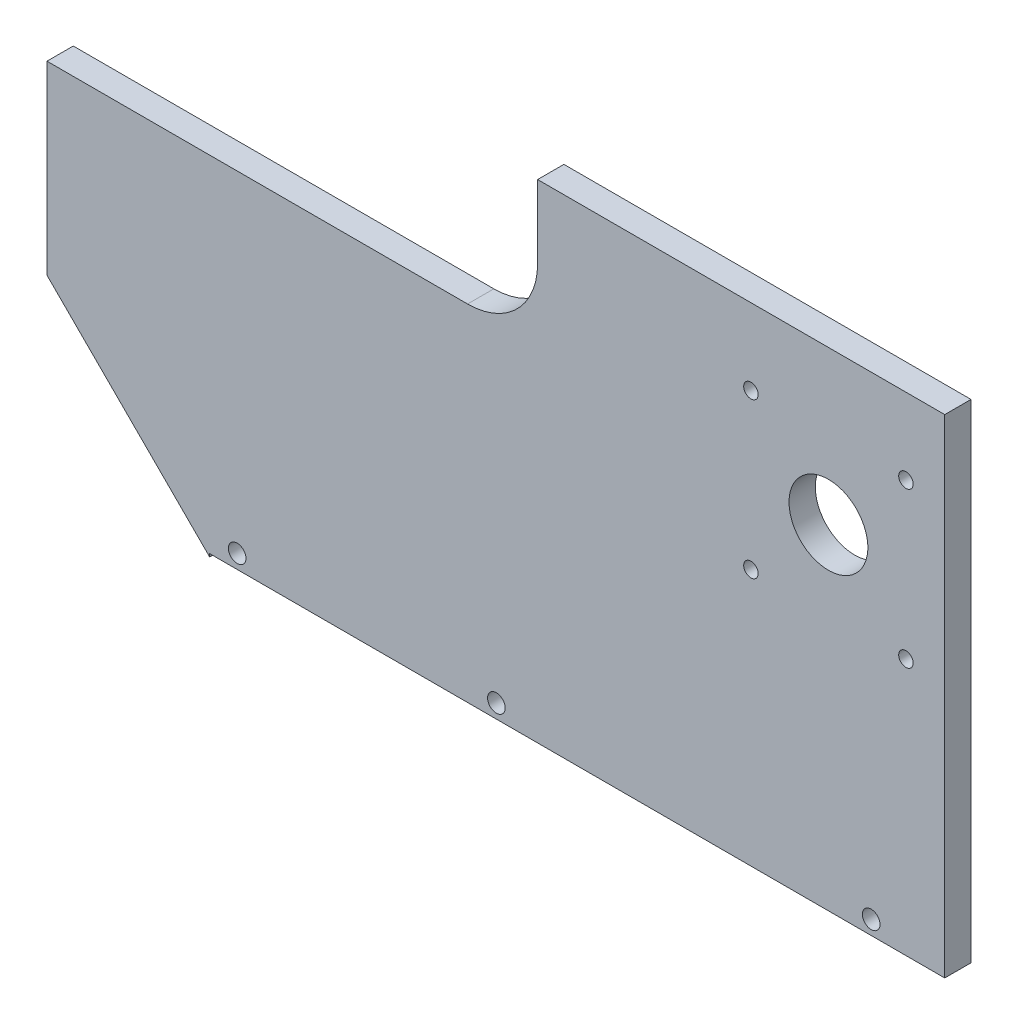
from build123d import *

# Parameters (mm, degrees)
SKETCH1_R                    = 14.2875
BOSS_EXTRUDE1_DEPTH          = 9.525
SKETCH2_W                    = 285.57287806
SKETCH2_H                    = 77.089
CUT_EXTRUDE1_DEPTH           = 269.40946762
SKETCH4_W                    = 213.36
SKETCH4_H                    = 68.767352002
CUT_EXTRUDE2_DEPTH           = 269.40946762
FILLET2_R                    = 25.4
SKETCH16_W                   = 9.525
SKETCH16_H                   = 4.28736328
CUT_EXTRUDE3_DEPTH           = 391.823448136
SKETCH17_W                   = 147.610011278
SKETCH17_H                   = 12.7
CUT_EXTRUDE4_DEPTH           = 267.045158533
TAP_DRILL_FOR_M6X0_75_TAP1_D = 5.25
F_6_4_6_4_DIAMETER_HOLE1_D   = 6.4
CUT_EXTRUDE5_DEPTH           = 260.331237793


with BuildPart() as part:
    # Sketch1 → Boss-Extrude1 (new body)
    with BuildSketch(Plane.XY):
        Polygon((-138.259383474, 48.991487021), (32.210627804, -121.478524257), (222.710627804, -121.478524257), (222.710627804, 149.508839023), (-138.259383474, 149.508839023), align=None)
        with Locations((180.538014078, 76.831975743)):
            Circle(SKETCH1_R, mode=Mode.SUBTRACT)
    extrude(amount=BOSS_EXTRUDE1_DEPTH)

    # Sketch2 → Cut-Extrude1 (cut, through all)
    with BuildSketch(Plane.XY.offset(9.525)):
        with Locations((98.974188774, -82.934024257)):
            Rectangle(SKETCH2_W, SKETCH2_H)
    extrude(amount=-CUT_EXTRUDE1_DEPTH, mode=Mode.SUBTRACT)

    # Sketch4 → Cut-Extrude2 (cut, through all)
    with BuildSketch(Plane.XY.offset(9.525)):
        with Locations((-31.579383474, 115.125163022)):
            Rectangle(SKETCH4_W, SKETCH4_H)
    extrude(amount=-CUT_EXTRUDE2_DEPTH, mode=Mode.SUBTRACT)

    # Fillet2
    fillet2_edges = [part.edges().sort_by_distance(p)[0] for p in [
        (-138.259383474, 80.741487021, 4.7625),
        (75.100616526, 80.741487021, 4.7625),
    ]]
    fillet(fillet2_edges, radius=FILLET2_R)

    # Sketch16 → Cut-Extrude3 (cut, through all)
    with BuildSketch(Plane(origin=(222.710627804, 0, 0), x_dir=(0, 0, -1), z_dir=(1, 0, 0))):
        with Locations((-4.7625, 147.365157383)):
            Rectangle(SKETCH16_W, SKETCH16_H)
    extrude(amount=-CUT_EXTRUDE3_DEPTH, mode=Mode.SUBTRACT)

    # Sketch17 → Cut-Extrude4 (cut, through all)
    with BuildSketch(Plane(origin=(0, 0, 0), x_dir=(-1, 0, 0), z_dir=(0, 0, -1))):
        with Locations((-148.905622165, 138.871475743)):
            Rectangle(SKETCH17_W, SKETCH17_H)
    extrude(amount=-CUT_EXTRUDE4_DEPTH, mode=Mode.SUBTRACT)

    # Tap Drill for M6x0.75 Tap1 (through all)
    with Locations(Plane.XY.offset(9.525)):
        with Locations((208.638014078, 104.931975743), (152.438014078, 104.931975743), (152.438014078, 48.731975743), (208.638014078, 48.731975743)):
            Hole(TAP_DRILL_FOR_M6X0_75_TAP1_D / 2)

    # Ø6.4 (6.4) Diameter Hole1 (through all)
    with Locations(Plane.XY.offset(9.525)):
        with Locations((196.040627804, -39.314524257), (60.150627804, -39.314524257), (-33.829372196, -39.314524257)):
            Hole(F_6_4_6_4_DIAMETER_HOLE1_D / 2)

    # Sketch22 → Cut-Extrude5 (cut, through all)
    with BuildSketch(Plane.XY.offset(9.525)):
        Polygon((-102.790372196, 145.085482826), (-102.790372196, -100.339530139), (-209.67575658, -95.573995907), (-209.67575658, 145.085482826), align=None)
    extrude(amount=-CUT_EXTRUDE5_DEPTH, mode=Mode.SUBTRACT)


solid = part.part
